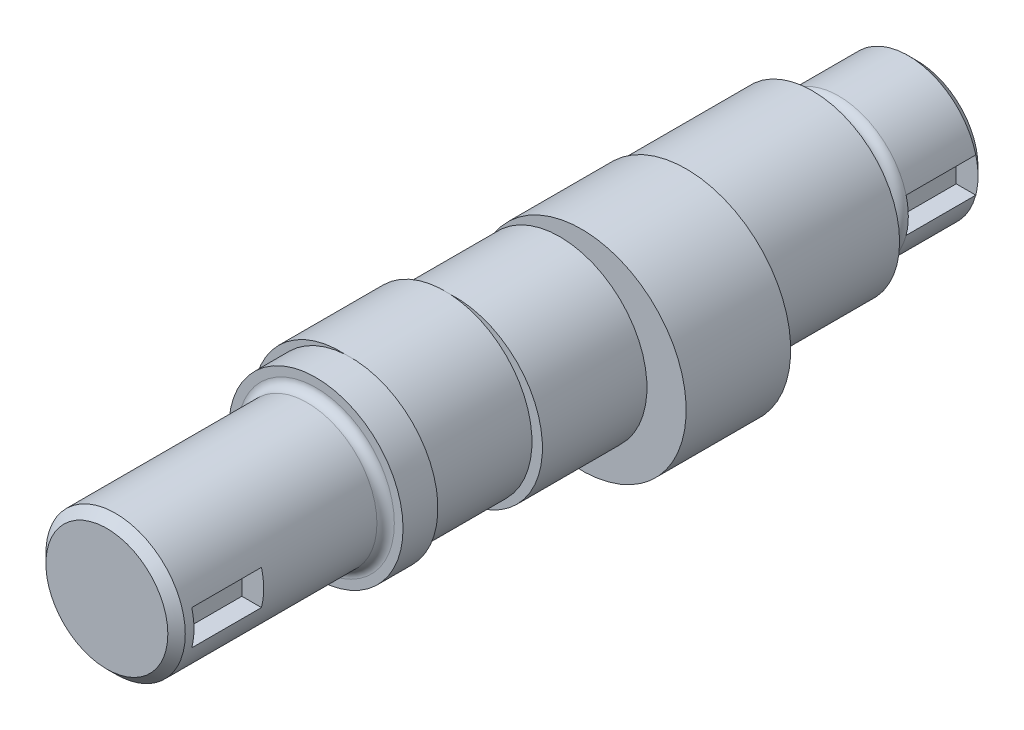
from build123d import *

# Parameters (mm, degrees)
SKETCH_1_R          = 8
EXTRUDE_1_DEPTH     = 10
SKETCH_2_R          = 6.5
EXTRUDE_2_DEPTH     = 2
SKETCH_3_R          = 10
EXTRUDE_3_DEPTH     = 17
SKETCH_4_R          = 12
EXTRUDE_4_DEPTH     = 12
SKETCH_5_R          = 10
EXTRUDE_5_DEPTH     = 12
SKETCH_6_R          = 10
EXTRUDE_6_DEPTH     = 12
SKETCH_7_R          = 10
EXTRUDE_7_DEPTH     = 4
SKETCH_8_R          = 8
EXTRUDE_8_DEPTH     = 24
SKETCH_9_W          = 5.5
SKETCH_9_H          = 4
CUT_EXTRUDE_1_DEPTH = 8
SKETCH_10_W         = 5.5
SKETCH_10_H         = 4
CUT_EXTRUDE_2_DEPTH = 8
CHAMFER_1_SIZE      = 1
FILLET_1_R          = 1


with BuildPart() as part:
    # 草图1 → 凸台-拉伸1 (new body)
    with BuildSketch(Plane.XY.offset(-13)):
        Circle(SKETCH_1_R)
    extrude(amount=EXTRUDE_1_DEPTH)

    # 草图2 → 凸台-拉伸2 (add)
    with BuildSketch(Plane.XY.offset(-3)):
        Circle(SKETCH_2_R)
    extrude(amount=EXTRUDE_2_DEPTH)

    # 草图3 → 凸台-拉伸3 (add)
    with BuildSketch(Plane.XY.offset(-1)):
        Circle(SKETCH_3_R)
    extrude(amount=EXTRUDE_3_DEPTH)

    # 草图4 → 凸台-拉伸4 (add)
    with BuildSketch(Plane.XY.offset(16)):
        with Locations(Location((2.5, 0, 0), (0, 0, 213.122940208))):
            Circle(SKETCH_4_R)
    extrude(amount=EXTRUDE_4_DEPTH)

    # 草图5 → 凸台-拉伸5 (add)
    with BuildSketch(Plane.XY.offset(28)):
        with Locations(Location((0, 0, 0), (0, 0, 139.025369771))):
            Circle(SKETCH_5_R)
    extrude(amount=EXTRUDE_5_DEPTH)

    # 草图6 → 凸台-拉伸6 (add)
    with BuildSketch(Plane.XY.offset(40)):
        with Locations(Location((-1.2, 0, 0), (0, 0, 273.439812768))):
            Circle(SKETCH_6_R)
    extrude(amount=EXTRUDE_6_DEPTH)

    # 草图7 → 凸台-拉伸7 (add)
    with BuildSketch(Plane.XY.offset(52)):
        with Locations(Location((0, 0, 0), (0, 0, 139.025369771))):
            Circle(SKETCH_7_R)
    extrude(amount=EXTRUDE_7_DEPTH)

    # 草图8 → 凸台-拉伸8 (add)
    with BuildSketch(Plane.XY.offset(56)):
        Circle(SKETCH_8_R)
    extrude(amount=EXTRUDE_8_DEPTH)

    # 草图9 → 切除-拉伸1 (cut)
    with BuildSketch(Plane.XY.offset(-12)):
        with Locations((8.25, 0)):
            Rectangle(SKETCH_9_W, SKETCH_9_H)
    extrude(amount=CUT_EXTRUDE_1_DEPTH, mode=Mode.SUBTRACT)

    # 草图10 → 切除-拉伸2 (cut)
    with BuildSketch(Plane.XY.offset(70)):
        with Locations((8.25, 0)):
            Rectangle(SKETCH_10_W, SKETCH_10_H)
    extrude(amount=CUT_EXTRUDE_2_DEPTH, mode=Mode.SUBTRACT)

    # 倒角1
    chamfer_1_edges = [part.edges().sort_by_distance(p)[0] for p in [
        (-8, 0, -13),
        (-8, 0, 80),
    ]]
    chamfer(chamfer_1_edges, length=CHAMFER_1_SIZE - 0.0001)  # a hair under: the kernel refuses the full size

    # 圆角1
    fillet_1_edges = [part.edges().sort_by_distance(p)[0] for p in [
        (-8, 0, 56),
        (-8, 0, -3),
        (-6.5, 0, -1),
    ]]
    fillet(fillet_1_edges, radius=FILLET_1_R - 0.0001)  # a hair under: the kernel refuses the full size


solid = part.part
